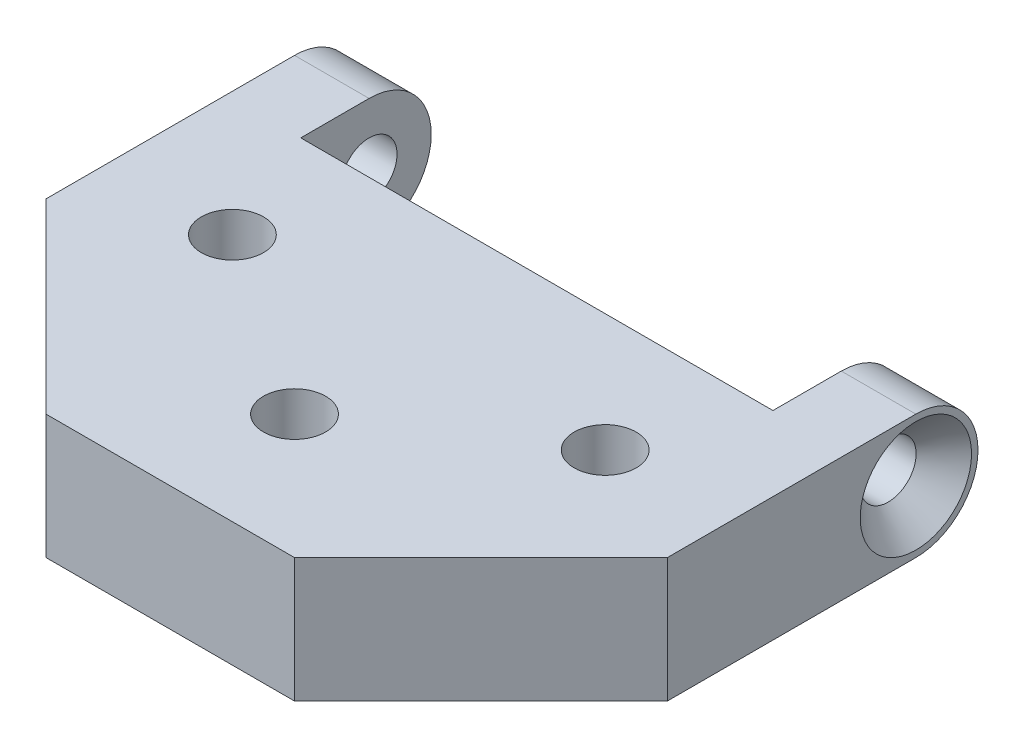
from build123d import *

# Parameters (mm, degrees)
BOSS_EXTRUDE1_DEPTH                     = 10
FILLET1_R                               = 5
CBORE_FOR_M5_HEX_HEAD_BOLT1_D           = 4.5
CBORE_FOR_M5_HEX_HEAD_BOLT1_DEPTH       = 10
CBORE_FOR_M5_HEX_HEAD_BOLT1_CBORE_D     = 5
CBORE_FOR_M5_HEX_HEAD_BOLT1_CBORE_DEPTH = 4.2
CBORE_FOR_M5_HEX_HEAD_BOLT1_TIP         = 1.351936393
CHAMFER1_SIZE                           = 15


with BuildPart() as part:
    # Sketch1 → Boss-Extrude1 (new body)
    with BuildSketch(Plane(origin=(0, 0, 0), x_dir=(1, 0, 0), z_dir=(0, 1, 0))):
        Polygon((-25, 20), (-25, -20), (25, -20), (25, 20), (19, 20), (19, 9.5), (-19, 9.5), (-19, 20), align=None)
    extrude(amount=BOSS_EXTRUDE1_DEPTH)

    # Fillet1
    fillet1_edges = [part.edges().sort_by_distance(p)[0] for p in [
        (22, 10, -20),
        (22, 0, -20),
        (-22, 0, -20),
        (-22, 10, -20),
    ]]
    fillet(fillet1_edges, radius=FILLET1_R - 0.0001)  # a hair under: the kernel refuses the full size

    # Sketch3 → CSK for M4 SFHCS1 (revolve, cut)
    with BuildSketch(Plane(origin=(25, 5, -15), x_dir=(0, 0, -1), z_dir=(0, 1, 0))):
        Polygon((0, 0), (0, 11.351936393), (2.25, 10), (2.25, 2.23), (4.48, 0), align=None)
    csk_for_m4_sfhcs1 = revolve(axis=Axis((31.35, 5, -15), (-1, 0, 0)), mode=Mode.SUBTRACT)

    # Mirror1: CSK for M4 SFHCS1 across plane
    add(csk_for_m4_sfhcs1.mirror(Plane(origin=(0, 0, 0), x_dir=(0, 0, 1), z_dir=(1, 0, 0))), mode=Mode.SUBTRACT)

    # CBORE for M5 Hex Head Bolt1
    with Locations(Plane(origin=(0, 10, 0), x_dir=(1, 0, 0), z_dir=(0, 1, 0))):
        with Locations((-15, 0), (15, 0), (0, -10)):
            CounterBoreHole(CBORE_FOR_M5_HEX_HEAD_BOLT1_D / 2, CBORE_FOR_M5_HEX_HEAD_BOLT1_CBORE_D / 2, CBORE_FOR_M5_HEX_HEAD_BOLT1_CBORE_DEPTH, depth=CBORE_FOR_M5_HEX_HEAD_BOLT1_DEPTH)
            with Locations((0, 0, -(CBORE_FOR_M5_HEX_HEAD_BOLT1_DEPTH + CBORE_FOR_M5_HEX_HEAD_BOLT1_TIP / 2))):  # 118° drill point
                Cone(0, CBORE_FOR_M5_HEX_HEAD_BOLT1_D / 2, CBORE_FOR_M5_HEX_HEAD_BOLT1_TIP, mode=Mode.SUBTRACT)

    # Chamfer1
    chamfer1_edges = [part.edges().sort_by_distance(p)[0] for p in [
        (25, 5, 20),
        (-25, 5, 20),
    ]]
    chamfer(chamfer1_edges, length=CHAMFER1_SIZE)


solid = part.part
